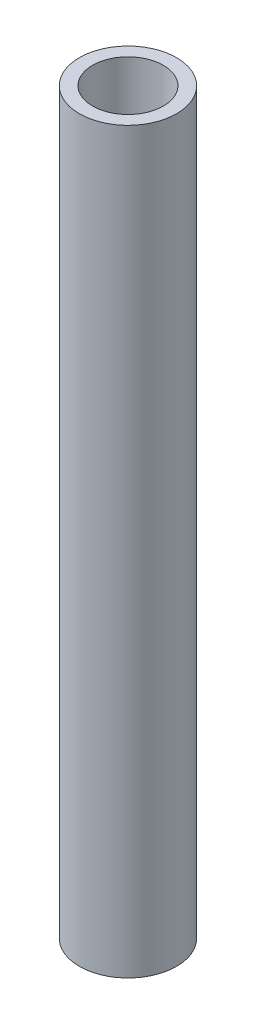
from build123d import *

# Parameters (mm, degrees)
SKETCH1_R           = 16.7132
SKETCH1_R_2         = 12.1666
BOSS_EXTRUDE1_DEPTH = 127


with BuildPart() as part:
    # Sketch1 → Boss-Extrude1 (new, symmetric)
    with BuildSketch(Plane(origin=(0, 0, 0), x_dir=(1, 0, 0), z_dir=(0, 1, 0))):
        Circle(SKETCH1_R)
        Circle(SKETCH1_R_2, mode=Mode.SUBTRACT)
    extrude(amount=BOSS_EXTRUDE1_DEPTH, both=True)


solid = part.part
